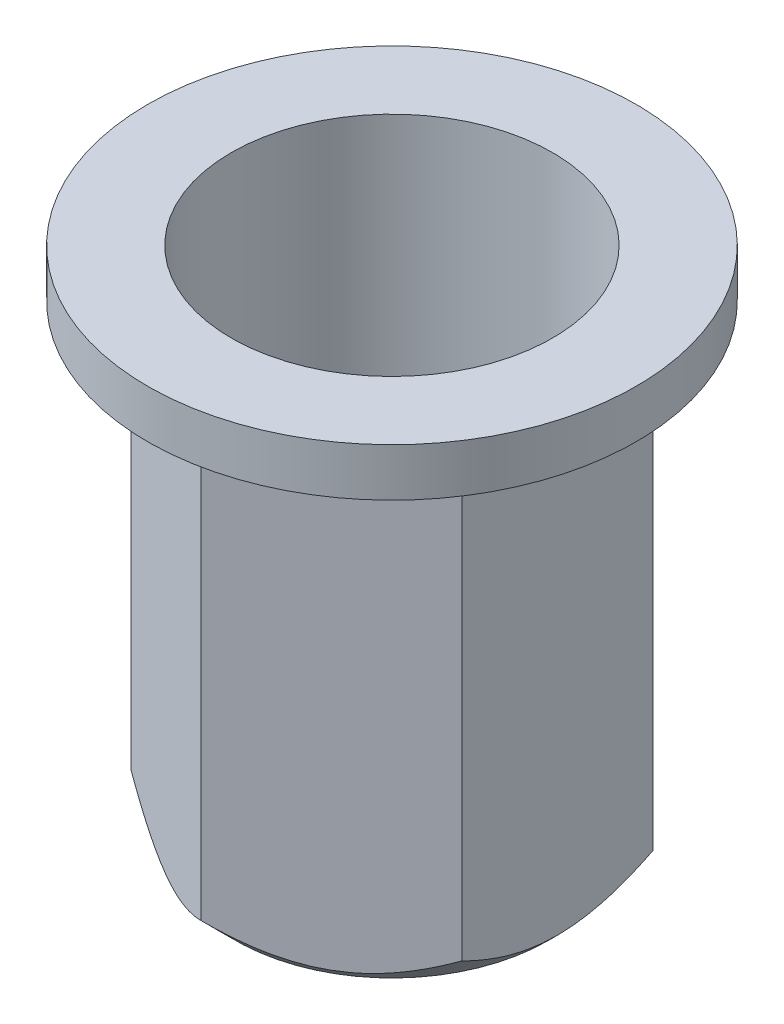
from build123d import *

# Parameters (mm, degrees)
CUT_SWEEP1_PITCH  = 1.27
SKETCH4_OUTSIDE_W = 17.042
SKETCH4_OUTSIDE_H = 17.042
EXTRUDE2_DEPTH    = 14.367267422


with BuildPart() as part:
    # Sketch1 → Revolve1 (revolve)
    with BuildSketch(Plane.XY):
        Polygon((-4.340750264, -11.11885), (-3.547000264, -11.9126), (-3.175, -11.9126), (-2.38125, -11.11885), (-2.38125, -6.8326), (-3.65125, -5.5626), (-3.65125, 0), (-5.5499, 0), (-5.5499, -1.0922), (-4.340750264, -1.0922), align=None)
    revolve(axis=Axis((0, 0, 0), (0, -1, 0)))

    # Cut-Sweep1: the profile of Sketch3 screwed along a right-hand helix of 15.231987 turns, 8 arcs to a turn; built about Z, then put on its axis
    cut_sweep1_z = Axis((0, 0, 0), (0, 0, 1))
    cut_sweep1_corners = [(2.281370036, 0, 0.5159375), (2.281370036, 0, -0.6746875), (3.175, 0, -0.15875), (3.220827178, 0, -0.079375), (3.175, 0, 0)]
    with BuildLine(mode=Mode.PRIVATE) as cut_sweep1_profile:
        Line(cut_sweep1_corners[0], cut_sweep1_corners[1])
        Line(cut_sweep1_corners[1], cut_sweep1_corners[2])
        Line(cut_sweep1_corners[4], cut_sweep1_corners[0])
        ThreePointArc((3.175, 0, -0.15875), (3.208547822, 0, -0.125202178), (3.220827178, 0, -0.079375))
        ThreePointArc((3.220827178, 0, -0.079375), (3.208547822, 0, -0.033547822), (3.175, 0, 0))
    cut_sweep1_cap = Face(cut_sweep1_profile.wire())
    cut_sweep1_arcs = [((3.175, 0, -0.15875), (3.220827178, 0, -0.132291667), (3.220827178, 0, -0.079375), (1, 0.86602540378444, 1)), ((3.220827178, 0, -0.079375), (3.220827178, 0, -0.026458333), (3.175, 0, 0), (1, 0.86602540378444, 1))]  # start, shoulder, end, weights
    cut_sweep1_turn_angles = [0, 22.5, 45, 67.5, 90, 112.5, 135, 157.5, 180, 202.5, 225, 247.5, 270, 292.5, 315, 337.5, 360]
    cut_sweep1_turn_weights = [1, 0.9238795325112867, 1, 0.9238795325112867, 1, 0.9238795325112867, 1, 0.9238795325112867, 1, 0.9238795325112867, 1, 0.9238795325112867, 1, 0.9238795325112867, 1, 0.9238795325112867, 1]
    cut_sweep1_turn_rails = [Edge.make_bspline([Vector(p[0], p[1], 0).rotate(cut_sweep1_z, cut_sweep1_turn_angles[k]) / cut_sweep1_turn_weights[k] + Vector(0, 0, p[2] + CUT_SWEEP1_PITCH * cut_sweep1_turn_angles[k] / 360) for k in range(17)], [0, 0, 0, 1, 1, 2, 2, 3, 3, 4, 4, 5, 5, 6, 6, 7, 7, 8, 8, 8], 2, cut_sweep1_turn_weights) for p in cut_sweep1_corners]
    cut_sweep1_turn_sides = [*[Face.make_surface_from_curves(cut_sweep1_turn_rails[p[0]], cut_sweep1_turn_rails[p[1]]) for p in [(0, 1), (1, 2), (4, 0)]], *[Face.make_bezier_surface([[Vector(p[j][0], p[j][1], 0).rotate(cut_sweep1_z, cut_sweep1_turn_angles[2 * i + k]) / cut_sweep1_turn_weights[2 * i + k] + Vector(0, 0, p[j][2] + CUT_SWEEP1_PITCH * cut_sweep1_turn_angles[2 * i + k] / 360) for k in range(3)] for j in range(3)], [[p[3][j] * cut_sweep1_turn_weights[2 * i + k] for k in range(3)] for j in range(3)]) for p in cut_sweep1_arcs for i in range(8)]]
    cut_sweep1_last_angles = [5400, 5422.5, 5445, 5464.25759572, 5483.515191441]
    cut_sweep1_last_weights = [1, 0.9238795325112867, 1, 0.9440453048996956, 1]
    cut_sweep1_last_rails = [Edge.make_bspline([Vector(p[0], p[1], 0).rotate(cut_sweep1_z, cut_sweep1_last_angles[k]) / cut_sweep1_last_weights[k] + Vector(0, 0, p[2] + CUT_SWEEP1_PITCH * cut_sweep1_last_angles[k] / 360) for k in range(5)], [0, 0, 0, 1, 1, 2, 2, 2], 2, cut_sweep1_last_weights) for p in cut_sweep1_corners]
    cut_sweep1_last_sides = [*[Face.make_surface_from_curves(cut_sweep1_last_rails[p[0]], cut_sweep1_last_rails[p[1]]) for p in [(0, 1), (1, 2), (4, 0)]], *[Face.make_bezier_surface([[Vector(p[j][0], p[j][1], 0).rotate(cut_sweep1_z, cut_sweep1_last_angles[2 * i + k]) / cut_sweep1_last_weights[2 * i + k] + Vector(0, 0, p[j][2] + CUT_SWEEP1_PITCH * cut_sweep1_last_angles[2 * i + k] / 360) for k in range(3)] for j in range(3)], [[p[3][j] * cut_sweep1_last_weights[2 * i + k] for k in range(3)] for j in range(3)]) for p in cut_sweep1_arcs for i in range(2)]]
    cut_sweep1 = Plane(origin=(0, -11.9126, 0), x_dir=(1, 0, 0), z_dir=(0, 1, 0)) * Solid(Shell([*[p.moved(Location((0, 0, CUT_SWEEP1_PITCH * i))) for i in range(15) for p in cut_sweep1_turn_sides], *cut_sweep1_last_sides, cut_sweep1_cap, cut_sweep1_cap.rotate(cut_sweep1_z, 5483.515191441).moved(Location((0, 0, CUT_SWEEP1_PITCH * 5483.515191441 / 360)))]))
    add(cut_sweep1, mode=Mode.SUBTRACT)

    # Sketch4 outside → Extrude2 (cut, through all)
    with BuildSketch(Plane.XZ.offset(1.0922)):
        Rectangle(SKETCH4_OUTSIDE_W, SKETCH4_OUTSIDE_H)
        Polygon((0, 4.340750264), (-3.7592, 2.170375132), (-3.7592, -2.170375132), (0, -4.340750264), (3.7592, -2.170375132), (3.7592, 2.170375132), align=None, mode=Mode.SUBTRACT)
    extrude(amount=EXTRUDE2_DEPTH, mode=Mode.SUBTRACT)


solid = part.part
